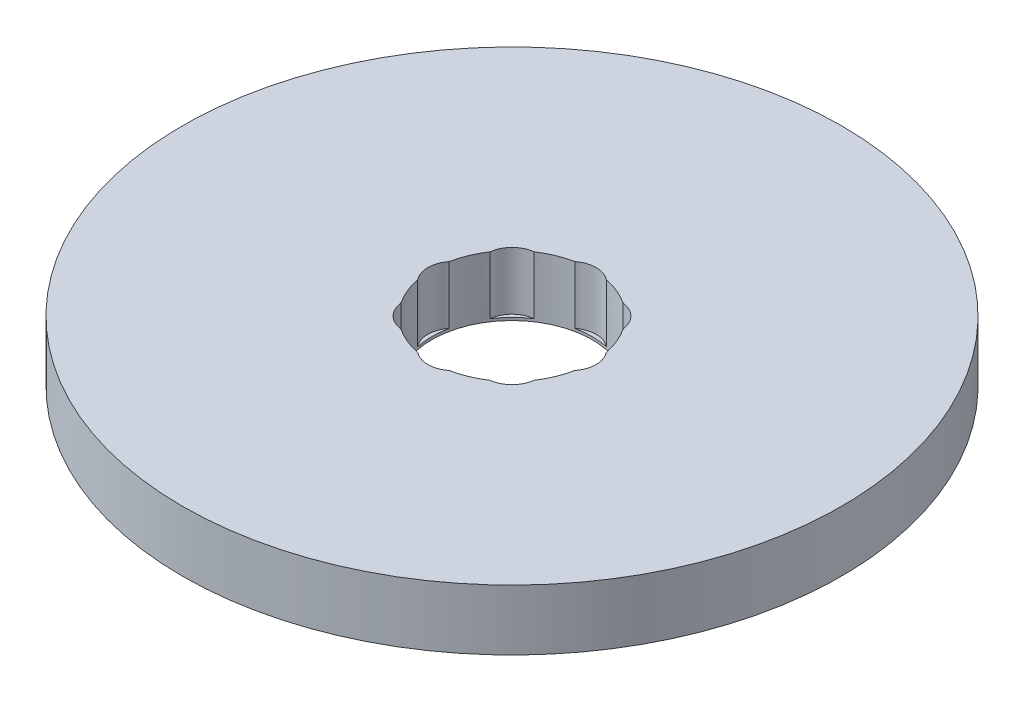
from build123d import *

# Parameters (mm, degrees)
SKETCH1_R           = 92.5
BOSS_EXTRUDE1_DEPTH = 17
SKETCH2_R           = 22.5
CUT_EXTRUDE1_DEPTH  = 132.914745196
SKETCH3_R           = 7.10537367
CUT_EXTRUDE2_DEPTH  = 16.242927573
CIRPATTERN1_COUNT   = 8


with BuildPart() as part:
    # Sketch1 → Boss-Extrude1 (new body)
    with BuildSketch(Plane(origin=(0, 0, 0), x_dir=(1, 0, 0), z_dir=(0, 1, 0))):
        Circle(SKETCH1_R)
    extrude(amount=BOSS_EXTRUDE1_DEPTH)

    # Sketch2 → Cut-Extrude1 (cut, through all)
    with BuildSketch(Plane(origin=(0, 0, 0), x_dir=(1, 0, 0), z_dir=(0, 1, 0))):
        Circle(SKETCH2_R)
    extrude(amount=CUT_EXTRUDE1_DEPTH, mode=Mode.SUBTRACT)

    # Sketch3 → Cut-Extrude2 (cut)
    with BuildSketch(Plane(origin=(0, 17, 0), x_dir=(1, 0, 0), z_dir=(0, 1, 0))):
        with Locations((-16.492462807, 0)):
            Circle(SKETCH3_R)
    cut_extrude2 = extrude(amount=-CUT_EXTRUDE2_DEPTH, mode=Mode.SUBTRACT)

    # CirPattern1: Cut-Extrude2 ×8 about axis
    cirpattern1_axis = Axis((0, 0, 0), (0, 1, 0))
    for i in range(1, CIRPATTERN1_COUNT):
        add(cut_extrude2.rotate(cirpattern1_axis, i * 360 / CIRPATTERN1_COUNT), mode=Mode.SUBTRACT)


solid = part.part
